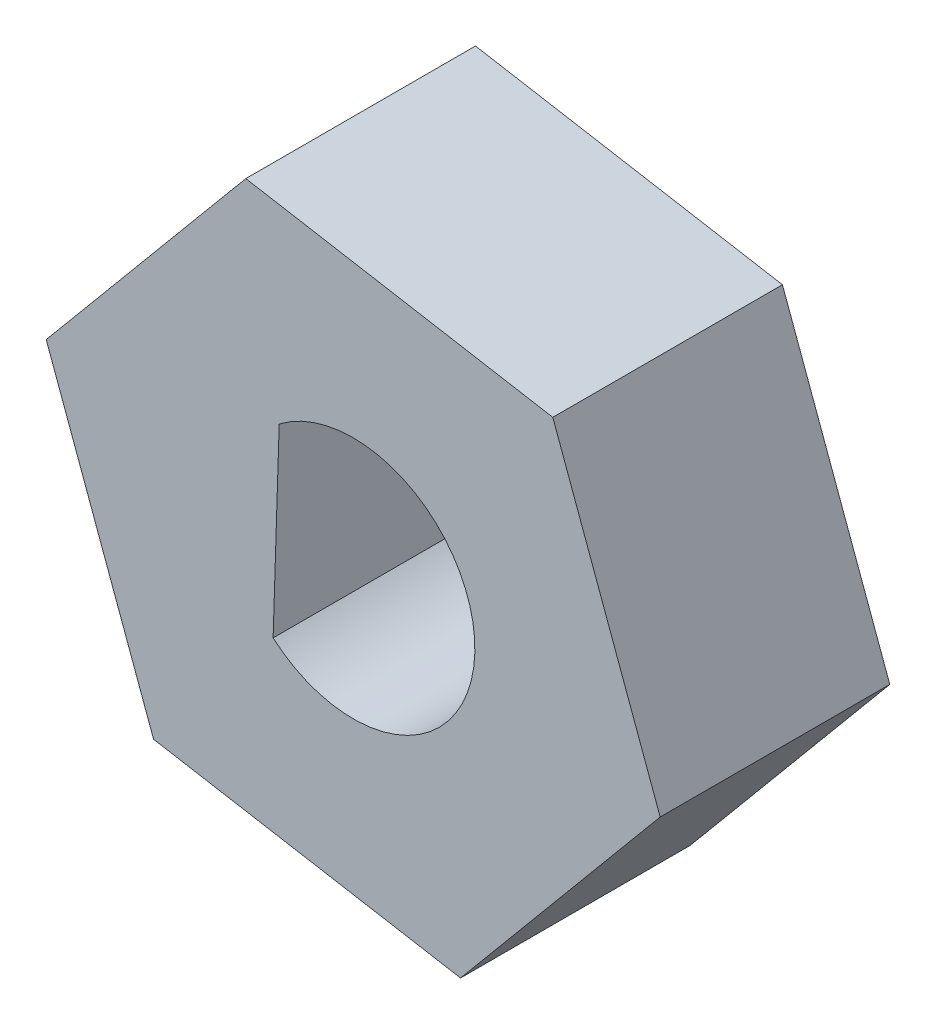
from build123d import *

# Parameters (mm, degrees)
BOSS_EXTRUDE1_DEPTH = 10
CUT_EXTRUDE1_DEPTH  = 10


with BuildPart() as part:
    # Sketch1 → Boss-Extrude1 (new body)
    with BuildSketch(Plane.XY):
        Polygon((8.692356553, 10.417594294), (-4.675723029, 12.736598741), (-13.368079582, 2.319004447), (-8.692356553, -10.417594294), (4.675723029, -12.736598741), (13.368079582, -2.319004447), align=None)
    extrude(amount=BOSS_EXTRUDE1_DEPTH)

    # Sketch3 → Cut-Extrude1 (cut)
    with BuildSketch(Plane(origin=(0, 0, 0), x_dir=(-1, 0, 0), z_dir=(0, 0, -1))):
        with BuildLine():
            Line((3.486710569, -3.99159735), (3.221699418, 4.20840265))
            ThreePointArc((3.221699418, 4.20840265), (-5.297234291, -0.171198312), (3.486710569, -3.99159735))
        make_face()
    extrude(amount=-CUT_EXTRUDE1_DEPTH, mode=Mode.SUBTRACT)


solid = part.part
